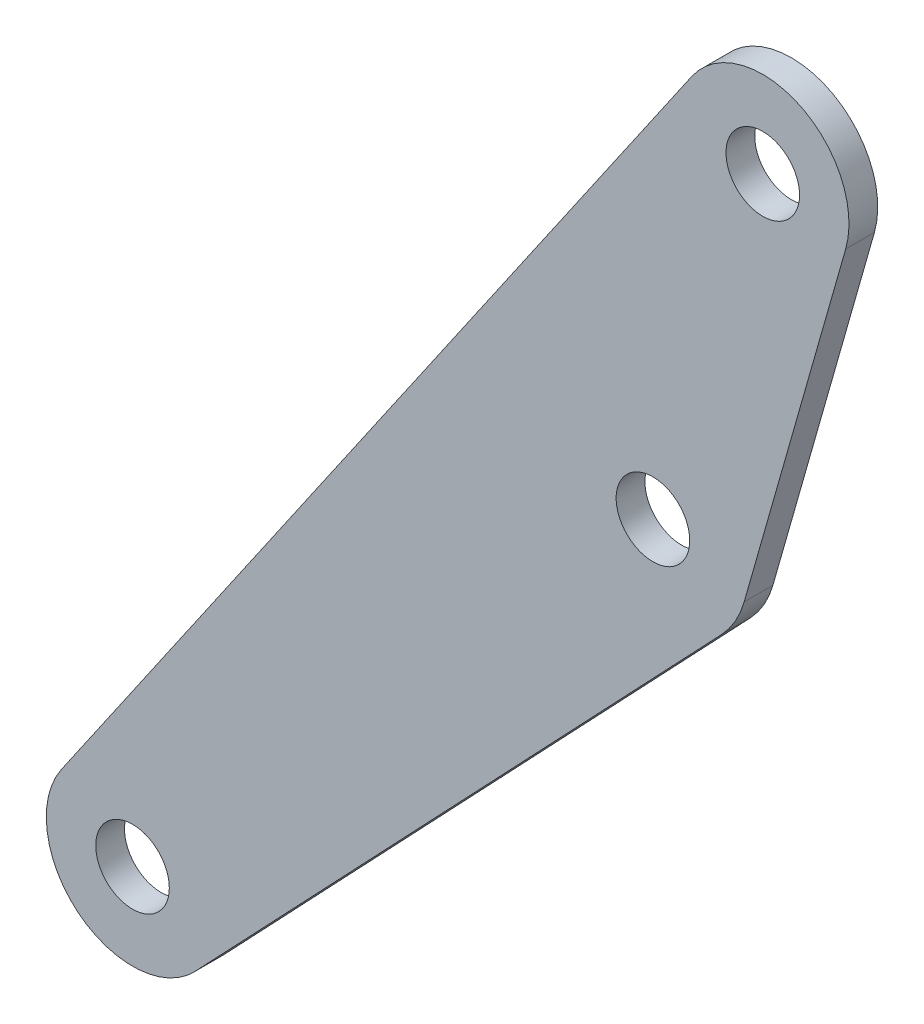
from build123d import *

# Parameters (mm, degrees)
SKETCH1_R           = 2.032
BOSS_EXTRUDE1_DEPTH = 1.5875


with BuildPart() as part:
    # Sketch1 → Boss-Extrude1 (new body)
    with BuildSketch(Plane.XY):
        with BuildLine():
            Line((5.03824479, -1.435475878), (10.647964222, 18.25356254))
            ThreePointArc((10.647964222, 18.25356254), (8.097686835, 23.866757057), (2.145415539, 22.259792886))
            Line((2.145415539, 22.259792886), (-32.669896907, -28.293430744))
            ThreePointArc((-32.669896907, -28.293430744), (-31.746196916, -34.694635373), (-25.29248438, -34.272454266))
            Line((-25.29248438, -34.272454266), (3.800595019, -3.605548373))
            ThreePointArc((3.800595019, -3.605548373), (4.550667638, -2.595366181), (5.03824479, -1.435475878))
        make_face()
        Circle(SKETCH1_R, mode=Mode.SUBTRACT)
        with Locations((6.067741686, 19.558540611)):
            Circle(SKETCH1_R, mode=Mode.SUBTRACT)
        with Locations((-28.74757076, -30.994683018)):
            Circle(SKETCH1_R, mode=Mode.SUBTRACT)
    extrude(amount=BOSS_EXTRUDE1_DEPTH)


solid = part.part
